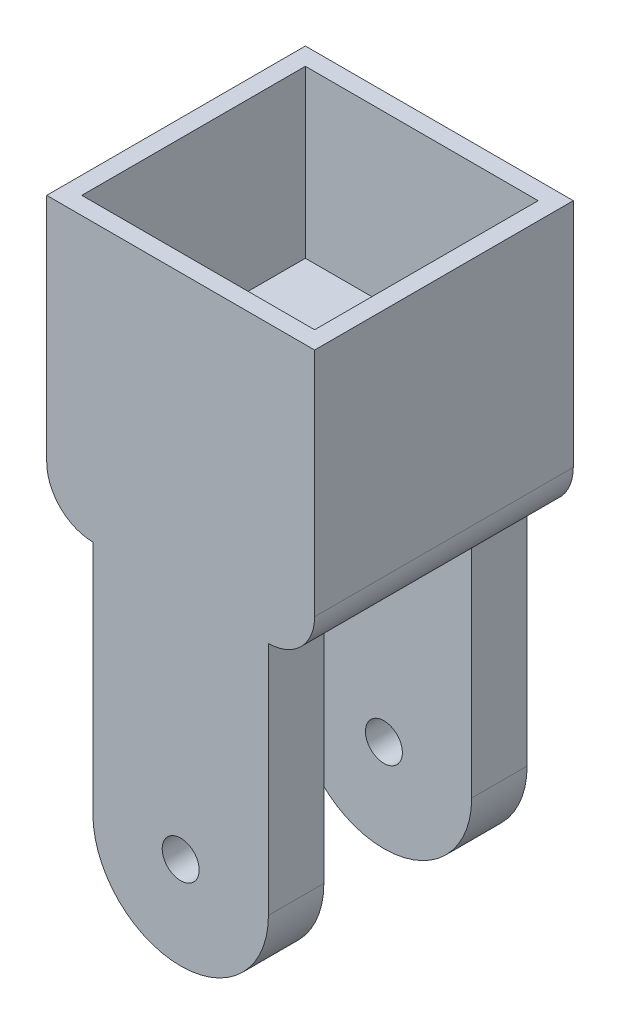
from build123d import *

# Parameters (mm, degrees)
SKETCH_1_W          = 29
SKETCH_1_H          = 28
EXTRUDE_3_DEPTH     = 30
SKETCH_2_W          = 19
SKETCH_2_H          = 6
EXTRUDE_4_DEPTH     = 35
SKETCH_3_R          = 2
CUT_EXTRUDE_3_DEPTH = 48.108916353
SKETCH_4_W          = 25.2
SKETCH_4_H          = 24.2
CUT_EXTRUDE_4_DEPTH = 18
CUT_EXTRUDE_START   = -18
SKETCH_4_3_R        = 5.1
CUT_EXTRUDE_5_DEPTH = 10
FILLET_1_R          = 5
FILLET_2_R          = 9.5


with BuildPart() as part:
    # 草图1 → 凸台-拉伸3 (new body)
    with BuildSketch(Plane(origin=(0, 0, 0), x_dir=(1, 0, 0), z_dir=(0, 1, 0))):
        Rectangle(SKETCH_1_W, SKETCH_1_H)
    extrude(amount=EXTRUDE_3_DEPTH)

    # 草图2 → 凸台-拉伸4 (add)
    with BuildSketch(Plane.XZ):
        with Locations((0, -11)):
            Rectangle(SKETCH_2_W, SKETCH_2_H)
        with Locations((0, 11)):
            Rectangle(SKETCH_2_W, SKETCH_2_H)
    extrude(amount=EXTRUDE_4_DEPTH)

    # 草图3 → 切除-拉伸3 (cut, through all)
    with BuildSketch(Plane(origin=(0, 0, -14), x_dir=(-1, 0, 0), z_dir=(0, 0, -1))):
        with Locations((0, -25)):
            Circle(SKETCH_3_R)
    extrude(amount=-CUT_EXTRUDE_3_DEPTH, mode=Mode.SUBTRACT)

    # 草图4 → 切除-拉伸4 (cut)
    with BuildSketch(Plane(origin=(0, 30, 0), x_dir=(1, 0, 0), z_dir=(0, 1, 0))):
        Rectangle(SKETCH_4_W, SKETCH_4_H)
    extrude(amount=-CUT_EXTRUDE_4_DEPTH, mode=Mode.SUBTRACT)

    # 草图4<3> → 切除-拉伸5 (cut)
    with BuildSketch(Plane(origin=(0, 30, 0), x_dir=(1, 0, 0), z_dir=(0, 1, 0)).offset(CUT_EXTRUDE_START)):
        with Locations(Location((0, 0, 0), (0, 0, 270))):
            Circle(SKETCH_4_3_R)
    extrude(amount=-CUT_EXTRUDE_5_DEPTH, mode=Mode.SUBTRACT)

    # 圆角1
    fillet_1_edges = [part.edges().sort_by_distance(p)[0] for p in [
        (-14.5, 0, 0),
        (14.5, 0, 0),
    ]]
    fillet(fillet_1_edges, radius=FILLET_1_R)

    # 圆角2
    fillet_2_edges = [part.edges().sort_by_distance(p)[0] for p in [
        (9.5, -35, -11),
        (-9.5, -35, -11),
        (9.5, -35, 11),
        (-9.5, -35, 11),
    ]]
    fillet(fillet_2_edges, radius=FILLET_2_R - 0.0001)  # a hair under: the kernel refuses the full size


solid = part.part
